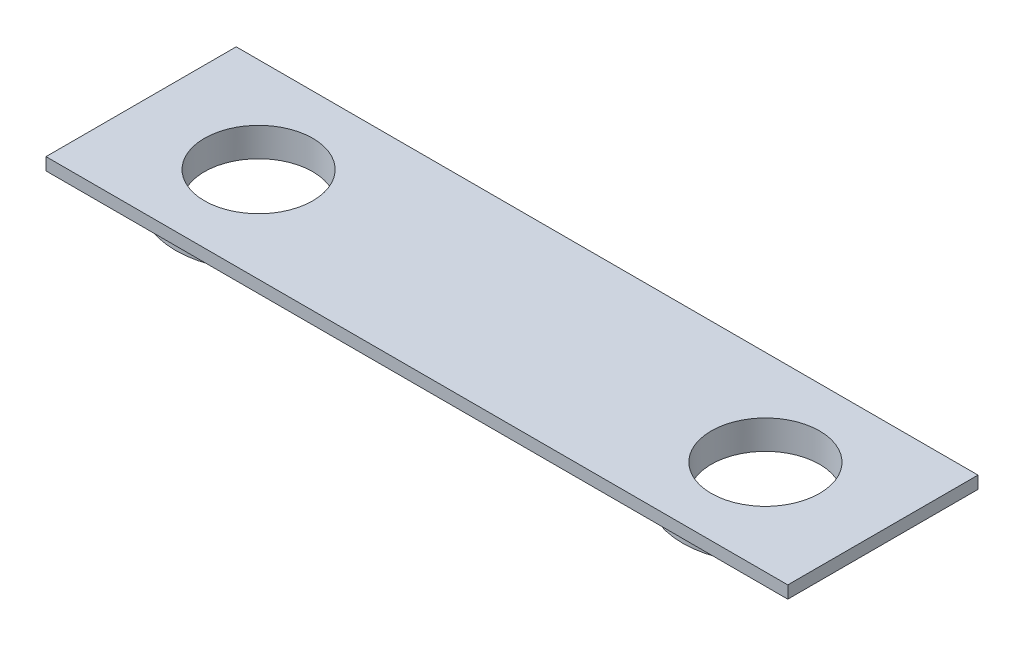
from build123d import *

# Parameters (mm, degrees)
SKETCH1_W           = 89.7
SKETCH1_H           = 23
SKETCH1_R           = 6.55
BOSS_EXTRUDE1_DEPTH = 1.5
BOSS_EXTRUDE2_START = 2
SKETCH2_R           = 10
SKETCH2_R_2         = 6.55
BOSS_EXTRUDE2_DEPTH = 2


with BuildPart() as part:
    # Sketch1 → Boss-Extrude1 (new body)
    with BuildSketch(Plane(origin=(0, 0, 0), x_dir=(1, 0, 0), z_dir=(0, 1, 0))):
        Rectangle(SKETCH1_W, SKETCH1_H)
        with Locations((-30.643, 0)):
            Circle(SKETCH1_R, mode=Mode.SUBTRACT)
        with Locations((30.643, 0)):
            Circle(SKETCH1_R, mode=Mode.SUBTRACT)
    extrude(amount=BOSS_EXTRUDE1_DEPTH)

    # Sketch2 → Boss-Extrude2 (add)
    # profile 1 of 2: a face of its own
    with BuildSketch(Plane.XZ.offset(BOSS_EXTRUDE2_START)):
        with Locations((-30.643, 0)):
            Circle(SKETCH2_R)
        with Locations((-30.643, 0)):
            Circle(SKETCH2_R_2, mode=Mode.SUBTRACT)
    # profile 2 of 2: a face of its own
    with BuildSketch(Plane.XZ.offset(BOSS_EXTRUDE2_START)):
        with Locations((30.643, 0)):
            Circle(SKETCH2_R)
        with Locations((30.643, 0)):
            Circle(SKETCH2_R_2, mode=Mode.SUBTRACT)
    extrude(amount=-BOSS_EXTRUDE2_DEPTH)


solid = part.part
